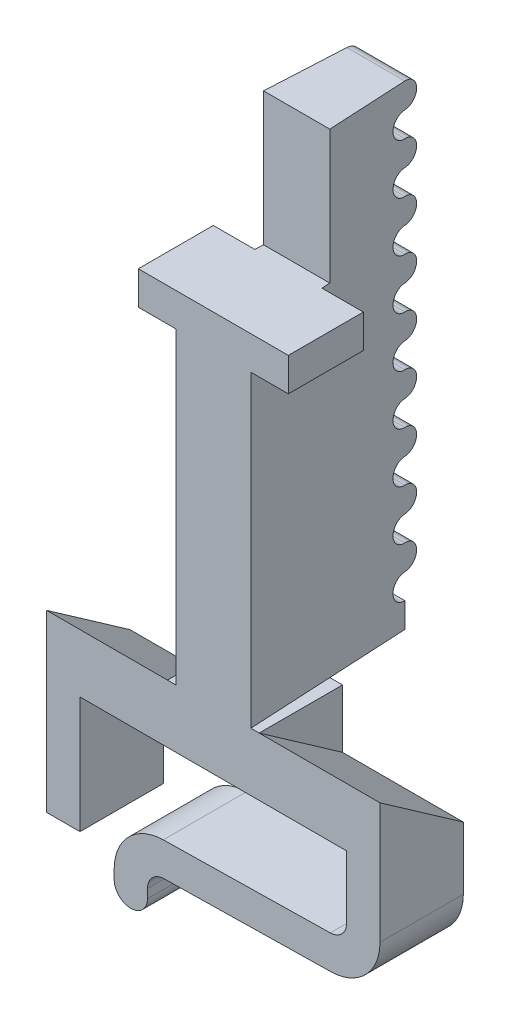
from build123d import *

# Parameters (mm, degrees)
BOSS_EXTRUDE1_DEPTH = 2.54
CUT_EXTRUDE2_DEPTH  = 3.683
CUT_EXTRUDE4_START  = 10.16
CUT_EXTRUDE4_DEPTH  = 3.683
SKETCH2_W           = 2.286
SKETCH2_H           = 14.478
BOSS_EXTRUDE2_DEPTH = 2.794
SKETCH3_W           = 1.143
SKETCH3_H           = 1.016
CUT_EXTRUDE5_DEPTH  = 0.254
DRAFT2_START        = 5.334
DRAFT2_DEPTH        = 14.478
DRAFT2_2_DEPTH      = 9.398
CUT_EXTRUDE6_DEPTH  = 23.895250599


# Read off the part's stored shape, not the designer's step: Draft2
with BuildPart() as part:
    # Model → Boss-Extrude1 (new body)
    with BuildSketch(Plane.XY):
        with BuildLine():
            Line((2.794, 15.748), (7.366, 15.748))
            Line((7.366, 15.748), (7.366, 14.732))
            Line((7.366, 14.732), (6.223, 14.732))
            Line((6.223, 14.732), (6.223, 5.334))
            Line((6.223, 5.334), (10.16, 5.334))
            Line((10.16, 5.334), (10.16, 1.650767887))
            ThreePointArc((10.16, 1.650767887), (9.722993685, 0.582582169), (8.662597467, 0.127))
            Line((8.662597467, 0.127), (3.572534178, 0.038152615))
            ThreePointArc((3.572534178, 0.038152615), (3.219068772, -0.113708108), (3.0734, -0.469770014))
            Line((3.0734, -0.469770014), (3.0734, -0.741620434))
            ThreePointArc((3.0734, -0.741620434), (2.5654, -1.249620434), (2.0574, -0.741620434))
            Line((2.0574, -0.741620434), (2.0574, -0.469770014))
            ThreePointArc((2.0574, -0.469770014), (2.494406315, 0.598415704), (3.554802533, 1.053997873))
            Line((3.554802533, 1.053997873), (8.644865822, 1.142845258))
            ThreePointArc((8.644865822, 1.142845258), (8.998331228, 1.294705981), (9.144, 1.650767887))
            Line((9.144, 1.650767887), (9.144, 3.556))
            Line((9.144, 3.556), (1.016, 3.556))
            Line((1.016, 3.556), (1.016, 0))
            Line((1.016, 0), (0, 0))
            Line((0, 0), (0, 5.334))
            Line((0, 5.334), (3.937, 5.334))
            Line((3.937, 5.334), (3.937, 14.732))
            Line((3.937, 14.732), (2.794, 14.732))
            Line((2.794, 14.732), (2.794, 15.748))
        make_face()
    extrude(amount=-BOSS_EXTRUDE1_DEPTH)

    # Sketch1 → Cut-Extrude2 (cut)
    with BuildSketch(Plane(origin=(0, 0, 0), x_dir=(0, 0, -1), z_dir=(1, 0, 0))):
        Polygon((0, 5.334), (2.54, 5.334), (2.54, 3.555472853), align=None)
    extrude(amount=CUT_EXTRUDE2_DEPTH, mode=Mode.SUBTRACT)

    # Sketch1<3> → Cut-Extrude4 (cut)
    with BuildSketch(Plane(origin=(0, 0, 0), x_dir=(0, 0, -1), z_dir=(1, 0, 0)).offset(CUT_EXTRUDE4_START)):
        Polygon((0, 5.334), (2.54, 5.334), (2.54, 3.555472853), align=None)
    extrude(amount=-CUT_EXTRUDE4_DEPTH, mode=Mode.SUBTRACT)

    # Sketch2 → Boss-Extrude2 (add)
    with BuildSketch(Plane(origin=(0, 0, -2.54), x_dir=(-1, 0, 0), z_dir=(0, 0, -1))):
        with Locations((-5.08, 12.573)):
            Rectangle(SKETCH2_W, SKETCH2_H)
    extrude(amount=BOSS_EXTRUDE2_DEPTH)

    # Sketch3 → Cut-Extrude5 (cut)
    with BuildSketch(Plane(origin=(0, 0, -2.54), x_dir=(-1, 0, 0), z_dir=(0, 0, -1))):
        with Locations((-6.7945, 15.24)):
            Rectangle(SKETCH3_W, SKETCH3_H)
        with Locations((-3.3655, 15.24)):
            Rectangle(SKETCH3_W, SKETCH3_H)
    extrude(amount=-CUT_EXTRUDE5_DEPTH, mode=Mode.SUBTRACT)

    # Draft2 outline → Draft2 (cut)
    with BuildSketch(Plane(origin=(0, 0, 0), x_dir=(1, 0, 0), z_dir=(0, 1, 0)).offset(DRAFT2_START)):
        Polygon((4.216543095, 5.334), (3.937, 5.334), (3.937, 2.286), (4.056804183, 2.286), align=None)
        Polygon((6.223, 5.334), (5.943456905, 5.334), (6.103195817, 2.286), (6.223, 2.286), align=None)
    extrude(amount=DRAFT2_DEPTH, mode=Mode.SUBTRACT)

    # Draft2 2 outline → Draft2 2 (cut)
    with BuildSketch(Plane(origin=(0, 0, 0), x_dir=(1, 0, 0), z_dir=(0, 1, 0)).offset(DRAFT2_START)):
        Polygon((3.937, 0), (4.056804184, 2.286), (3.937, 2.286), align=None)
        Polygon((6.223, 2.286), (6.103195817, 2.286), (6.223, 0), align=None)
    extrude(amount=DRAFT2_2_DEPTH, mode=Mode.SUBTRACT)

    # Sketch4 → Cut-Extrude6 (cut, through all)
    with BuildSketch(Plane(origin=(0, 0, 0), x_dir=(0, 0, -1), z_dir=(1, 0, 0))):
        with BuildLine():
            ThreePointArc((4.953, 19.812), (5.222407684, 19.700407684), (5.334, 19.431))
            Line((5.334, 19.431), (5.334, 19.812))
            Line((5.334, 19.812), (4.953, 19.812))
        make_face()
        with BuildLine():
            ThreePointArc((4.953, 18.288), (5.222407684, 18.176407684), (5.334, 17.907))
            Line((5.334, 17.907), (5.334, 19.431))
            ThreePointArc((5.334, 19.431), (5.222407684, 19.161592316), (4.953, 19.05))
            ThreePointArc((4.953, 19.05), (4.683592316, 18.938407684), (4.572, 18.669))
            ThreePointArc((4.572, 18.669), (4.683592316, 18.399592316), (4.953, 18.288))
        make_face()
        with BuildLine():
            ThreePointArc((4.953, 16.764), (5.222407684, 16.652407684), (5.334, 16.383))
            Line((5.334, 16.383), (5.334, 17.907))
            ThreePointArc((5.334, 17.907), (5.222407684, 17.637592316), (4.953, 17.526))
            ThreePointArc((4.953, 17.526), (4.683592316, 17.414407684), (4.572, 17.145))
            ThreePointArc((4.572, 17.145), (4.683592316, 16.875592316), (4.953, 16.764))
        make_face()
        with BuildLine():
            ThreePointArc((4.953, 15.24), (5.222407684, 15.128407684), (5.334, 14.859))
            Line((5.334, 14.859), (5.334, 16.383))
            ThreePointArc((5.334, 16.383), (5.222407684, 16.113592316), (4.953, 16.002))
            ThreePointArc((4.953, 16.002), (4.683592316, 15.890407684), (4.572, 15.621))
            ThreePointArc((4.572, 15.621), (4.683592316, 15.351592316), (4.953, 15.24))
        make_face()
        with BuildLine():
            ThreePointArc((4.953, 13.716), (5.222407684, 13.604407684), (5.334, 13.335))
            Line((5.334, 13.335), (5.334, 14.859))
            ThreePointArc((5.334, 14.859), (5.222407684, 14.589592316), (4.953, 14.478))
            ThreePointArc((4.953, 14.478), (4.683592316, 14.366407684), (4.572, 14.097))
            ThreePointArc((4.572, 14.097), (4.683592316, 13.827592316), (4.953, 13.716))
        make_face()
        with BuildLine():
            ThreePointArc((4.953, 12.192), (5.222407684, 12.080407684), (5.334, 11.811))
            Line((5.334, 11.811), (5.334, 13.335))
            ThreePointArc((5.334, 13.335), (5.222407684, 13.065592316), (4.953, 12.954))
            ThreePointArc((4.953, 12.954), (4.683592316, 12.842407684), (4.572, 12.573))
            ThreePointArc((4.572, 12.573), (4.683592316, 12.303592316), (4.953, 12.192))
        make_face()
        with BuildLine():
            ThreePointArc((4.953, 10.668), (5.222407684, 10.556407684), (5.334, 10.287))
            Line((5.334, 10.287), (5.334, 11.811))
            ThreePointArc((5.334, 11.811), (5.222407684, 11.541592316), (4.953, 11.43))
            ThreePointArc((4.953, 11.43), (4.683592316, 11.318407684), (4.572, 11.049))
            ThreePointArc((4.572, 11.049), (4.683592316, 10.779592316), (4.953, 10.668))
        make_face()
        with BuildLine():
            ThreePointArc((4.953, 9.144), (5.222407684, 9.032407684), (5.334, 8.763))
            Line((5.334, 8.763), (5.334, 10.287))
            ThreePointArc((5.334, 10.287), (5.222407684, 10.017592316), (4.953, 9.906))
            ThreePointArc((4.953, 9.906), (4.683592316, 9.794407684), (4.572, 9.525))
            ThreePointArc((4.572, 9.525), (4.683592316, 9.255592316), (4.953, 9.144))
        make_face()
        with BuildLine():
            ThreePointArc((4.953, 7.62), (5.222407684, 7.508407684), (5.334, 7.239))
            Line((5.334, 7.239), (5.334, 8.763))
            ThreePointArc((5.334, 8.763), (5.222407684, 8.493592316), (4.953, 8.382))
            ThreePointArc((4.953, 8.382), (4.683592316, 8.270407684), (4.572, 8.001))
            ThreePointArc((4.572, 8.001), (4.683592316, 7.731592316), (4.953, 7.62))
        make_face()
        with BuildLine():
            ThreePointArc((4.572, 6.477), (4.683592316, 6.207592316), (4.953, 6.096))
            Line((4.953, 6.096), (4.953, 3.556))
            Line((4.953, 3.556), (5.334, 3.556))
            Line((5.334, 3.556), (5.334, 7.239))
            ThreePointArc((5.334, 7.239), (5.222407684, 6.969592316), (4.953, 6.858))
            ThreePointArc((4.953, 6.858), (4.683592316, 6.746407684), (4.572, 6.477))
        make_face()
    extrude(amount=CUT_EXTRUDE6_DEPTH, mode=Mode.SUBTRACT)


solid = part.part
